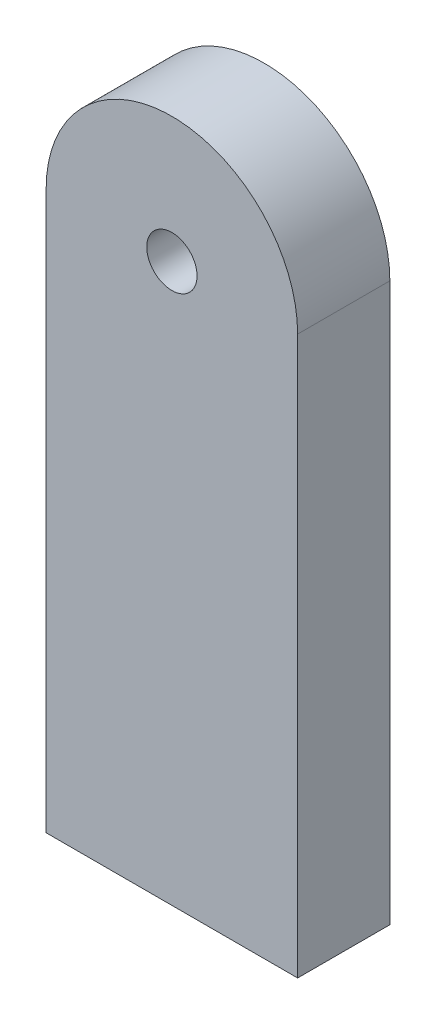
from build123d import *

# Parameters (mm, degrees)
BOSS_EXTRUDE1_DEPTH = 2.5
SKETCH3_R           = 1.5
BOSS_EXTRUDE2_DEPTH = 3


with BuildPart() as part:
    # Sketch1 → Boss-Extrude1 (new body)
    with BuildSketch(Plane.XY):
        with BuildLine():
            ThreePointArc((7.457118183, 0.082245335), (-0.042881817, 7.582245335), (-7.542881817, 0.082245335))
            Line((-7.542881817, 0.082245335), (-7.542881817, -33.176547175))
            Line((-7.542881817, -33.176547175), (7.457118183, -33.176547175))
            Line((7.457118183, -33.176547175), (7.457118183, 0.082245335))
        make_face()
        Polygon((1.632118183, 2.983430437), (3.307118183, 0.082245335), (1.632118183, -2.818939768), (-0.042881817, -2.818939768), (-1.717881817, -2.818939768), (-3.392881817, 0.082245335), (-1.717881817, 2.983430437), (-0.042881817, 2.983430437), align=None, mode=Mode.SUBTRACT)
    extrude(amount=BOSS_EXTRUDE1_DEPTH)

    # Sketch3 → Boss-Extrude2 (add)
    with BuildSketch(Plane.XY.offset(2.5)):
        with BuildLine():
            Line((7.457118183, 0.082245335), (7.457118183, -33.176547175))
            Line((7.457118183, -33.176547175), (-7.542881817, -33.176547175))
            Line((-7.542881817, -33.176547175), (-7.542881817, 0.082245335))
            ThreePointArc((-7.542881817, 0.082245335), (-0.042881817, 7.582245335), (7.457118183, 0.082245335))
        make_face()
        with Locations((-0.042881817, 0.082245335)):
            Circle(SKETCH3_R, mode=Mode.SUBTRACT)
    extrude(amount=BOSS_EXTRUDE2_DEPTH)


solid = part.part
